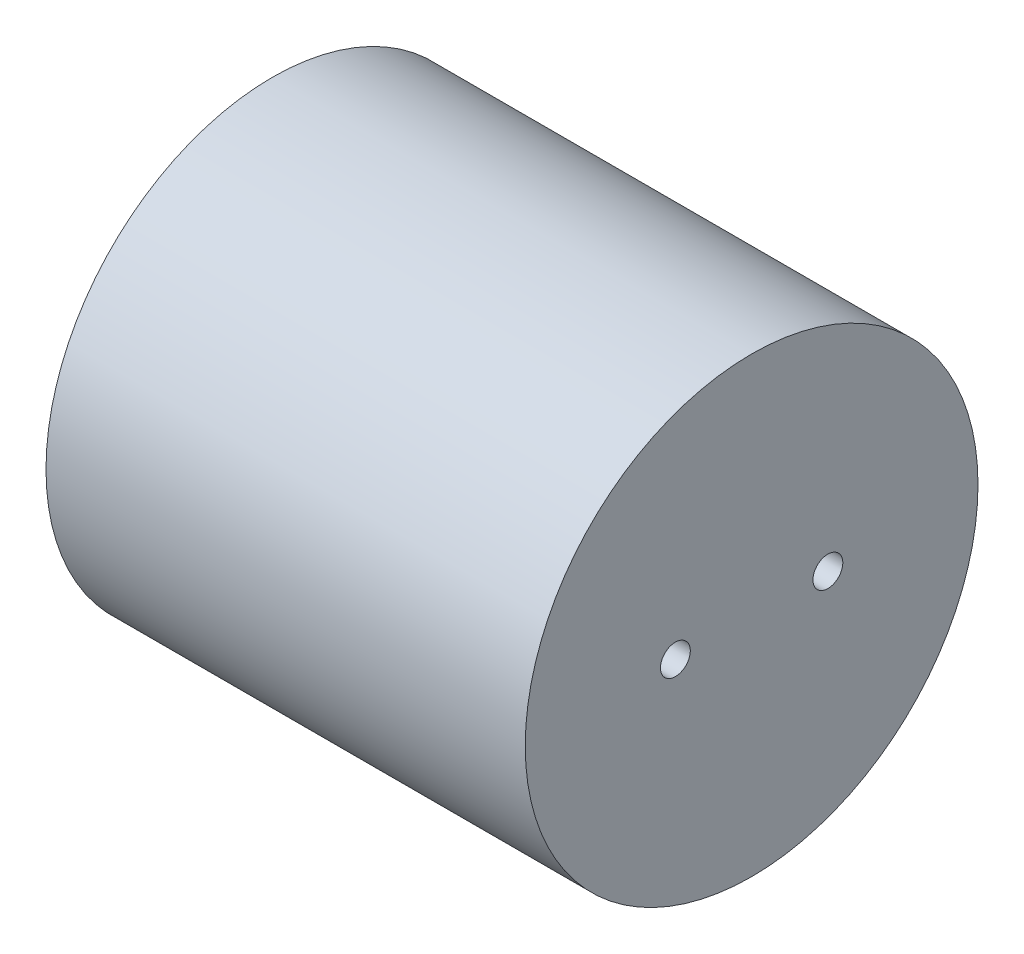
from build123d import *

# Parameters (mm, degrees)
SKETCH2_R                   = 49.4919
BOSS_EXTRUDE1_DEPTH         = 104.775
SKETCH3_W                   = 55.5625
SKETCH3_H                   = 22.225
CUT_EXTRUDE1_DEPTH          = 88.9
F_5_16_18_TAPPED_HOLE1_D    = 6.5278
F_1_4_20_TAPPED_HOLE1_D     = 5.1054
F_1_4_20_TAPPED_HOLE1_DEPTH = 76.2
F_1_4_20_TAPPED_HOLE1_TIP   = 1.533816902


with BuildPart() as part:
    # Sketch2 → Boss-Extrude1 (new body)
    with BuildSketch(Plane(origin=(0, 0, 0), x_dir=(0, 0, -1), z_dir=(1, 0, 0))):
        Circle(SKETCH2_R)
    extrude(amount=BOSS_EXTRUDE1_DEPTH)

    # Sketch3 → Cut-Extrude1 (cut)
    with BuildSketch(Plane.ZY):
        Rectangle(SKETCH3_W, SKETCH3_H)
    extrude(amount=-CUT_EXTRUDE1_DEPTH, mode=Mode.SUBTRACT)

    # 5/16-18 Tapped Hole1 (through all)
    with Locations(Plane.ZY.offset(-88.9)):
        with Locations((-16.66875, 0), (16.66875, 0)):
            Hole(F_5_16_18_TAPPED_HOLE1_D / 2)

    # 1/4-20 Tapped Hole1
    with Locations(Plane.ZY):
        with Locations((-22.225, 22.225), (-22.225, -22.225), (22.225, -22.225), (22.225, 22.225)):
            Hole(F_1_4_20_TAPPED_HOLE1_D / 2, depth=F_1_4_20_TAPPED_HOLE1_DEPTH)
            with Locations((0, 0, -(F_1_4_20_TAPPED_HOLE1_DEPTH + F_1_4_20_TAPPED_HOLE1_TIP / 2))):  # 118° drill point
                Cone(0, F_1_4_20_TAPPED_HOLE1_D / 2, F_1_4_20_TAPPED_HOLE1_TIP, mode=Mode.SUBTRACT)


solid = part.part
